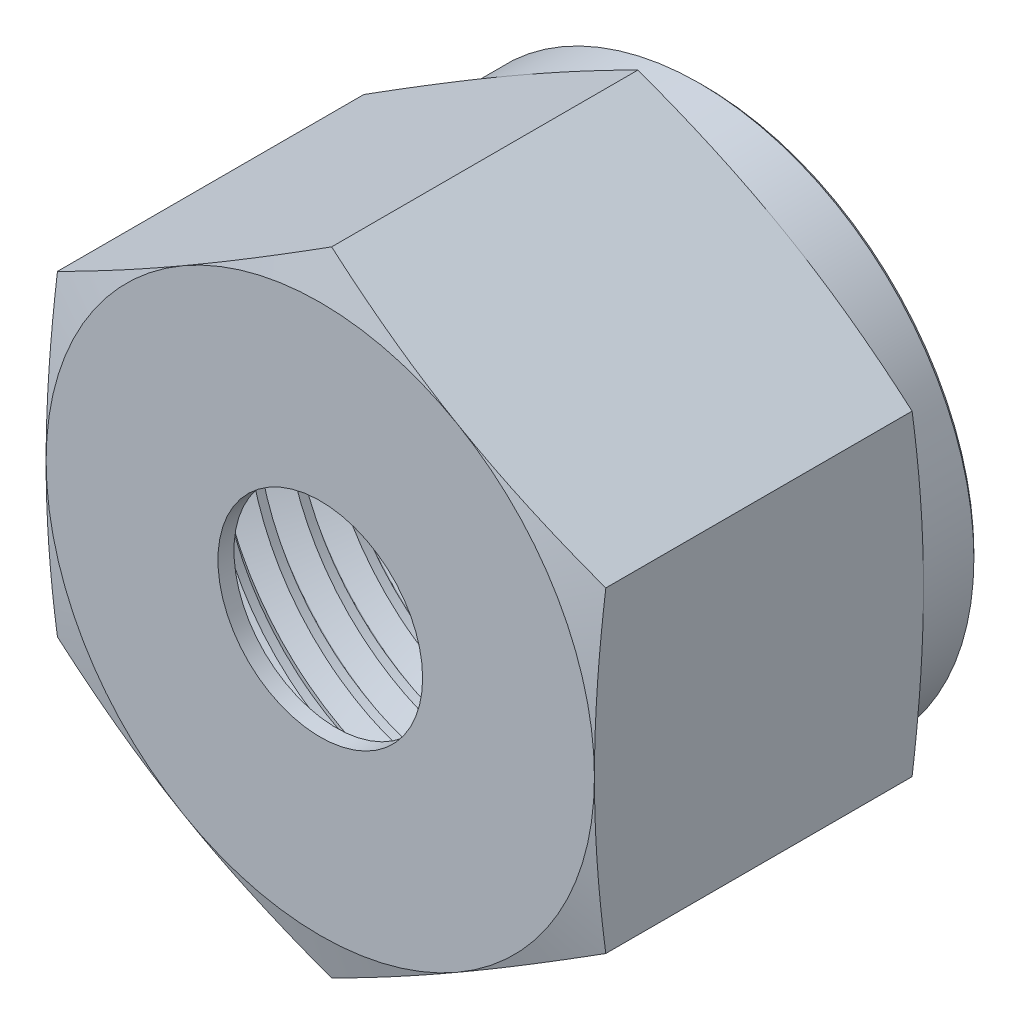
from build123d import *
from build123d.topology import SkipClean

# Parameters (mm, degrees)
BOSS_EXTRUDE1_DEPTH = 25.9334
FILLET1_R           = 1.5748
CHAMFER1_SIZE       = 0.254
CHAMFER2_SIZE       = 0.254
CUT_SWEEP1_PITCH    = 2.116666667
SKETCH7_W           = 9.611261518
SKETCH7_H           = 37.336478418
CUT_EXTRUDE2_DEPTH  = 19.05
SKETCH8_W           = 0.928463728
SKETCH8_H           = 7.62


with BuildPart() as part:
    # Sketch1 → Boss-Extrude1 (new body)
    with BuildSketch(Plane.XY):
        Polygon((0, 18.330871047), (-15.875, 9.165435523), (-15.875, -9.165435523), (0, -18.330871047), (15.875, -9.165435523), (15.875, 9.165435523), align=None)
    extrude(amount=BOSS_EXTRUDE1_DEPTH)

    # Sketch2 → Cut-Revolve1 (revolve, cut)
    with BuildSketch(Plane(origin=(0, 0, 0), x_dir=(0, 0, -1), z_dir=(1, 0, 0))):
        Polygon((-25.9334, 20.786742094), (-25.9334, 15.875), (-22.225, 15.875), (-21.566951336, 18.330871047), (-3.833048664, 18.330871047), (-3.175, 15.875), (0, 15.875), (0, 20.786742094), align=None)
        with BuildLine():
            Line((-25.9334, 10.5918), (-25.9334, 0))
            Line((-25.9334, 0), (0, 0))
            Line((0, 0), (0, 12.720416378))
            Line((0, 12.720416378), (-21.7932, 12.720416378))
            ThreePointArc((-21.7932, 12.720416378), (-21.972805122, 12.6460215), (-22.0472, 12.466416378))
            Line((-22.0472, 12.466416378), (-22.0472, 10.5918))
            Line((-22.0472, 10.5918), (-25.9334, 10.5918))
        make_face()
    revolve(axis=Axis((0, 0, 0), (0, 0, 1)), mode=Mode.SUBTRACT)

    # Fillet1
    fillet1_edges = [part.edges().sort_by_distance(p)[0] for p in [
        (0, -15.875, 25.9334),
    ]]
    fillet(fillet1_edges, radius=FILLET1_R)

    # Chamfer1
    chamfer1_edges = [part.edges().sort_by_distance(p)[0] for p in [
        (0, -15.875, 0),
    ]]
    chamfer(chamfer1_edges, length=CHAMFER1_SIZE)

    # Chamfer2
    chamfer2_edges = [part.edges().sort_by_distance(p)[0] for p in [
        (0, -10.5918, 25.9334),
        (0, -10.5918, 22.0472),
    ]]
    chamfer(chamfer2_edges, length=CHAMFER2_SIZE)

    # Cut-Sweep1: the profile of Sketch4 screwed along a right-hand helix of 10.036 turns, 10 arcs to a turn; built about Z, then put on its axis
    cut_sweep1_z = Axis((0, 0, 0), (0, 0, 1))
    cut_sweep1_corners = [(13.952021776, 0, -0.711067708), (12.505601483, 0, 0.124023437), (12.505601483, 0, -1.744596354), (13.952021776, 0, -0.909505208), (14.009305748, 0, -0.810286458)]
    with BuildLine(mode=Mode.PRIVATE) as cut_sweep1_profile:
        Line(cut_sweep1_corners[0], cut_sweep1_corners[1])
        Line(cut_sweep1_corners[1], cut_sweep1_corners[2])
        Line(cut_sweep1_corners[2], cut_sweep1_corners[3])
        ThreePointArc((13.952021776, 0, -0.909505208), (13.993956554, 0, -0.86757043), (14.009305748, 0, -0.810286458))
        ThreePointArc((14.009305748, 0, -0.810286458), (13.993956554, 0, -0.753002486), (13.952021776, 0, -0.711067708))
    cut_sweep1_cap = Face(cut_sweep1_profile.wire())
    cut_sweep1_arcs = [((13.952021776, 0, -0.909505208), (14.009305748, 0, -0.876432292), (14.009305748, 0, -0.810286458), (1, 0.8660254037844366, 1)), ((14.009305748, 0, -0.810286458), (14.009305748, 0, -0.744140625), (13.952021776, 0, -0.711067708), (1, 0.8660254037844366, 1))]  # start, shoulder, end, weights
    cut_sweep1_turn_angles = [0, 18, 36, 54, 72, 90, 108, 126, 144, 162, 180, 198, 216, 234, 252, 270, 288, 306, 324, 342, 360]
    cut_sweep1_turn_weights = [1, 0.9510565162951535, 1, 0.9510565162951535, 1, 0.9510565162951535, 1, 0.9510565162951535, 1, 0.9510565162951535, 1, 0.9510565162951535, 1, 0.9510565162951535, 1, 0.9510565162951535, 1, 0.9510565162951535, 1, 0.9510565162951535, 1]
    cut_sweep1_turn_rails = [Edge.make_bspline([Vector(p[0], p[1], 0).rotate(cut_sweep1_z, cut_sweep1_turn_angles[k]) / cut_sweep1_turn_weights[k] + Vector(0, 0, p[2] + CUT_SWEEP1_PITCH * cut_sweep1_turn_angles[k] / 360) for k in range(21)], [0, 0, 0, 1, 1, 2, 2, 3, 3, 4, 4, 5, 5, 6, 6, 7, 7, 8, 8, 9, 9, 10, 10, 10], 2, cut_sweep1_turn_weights) for p in cut_sweep1_corners]
    cut_sweep1_turn_sides = [*[Face.make_surface_from_curves(cut_sweep1_turn_rails[p[0]], cut_sweep1_turn_rails[p[1]]) for p in [(0, 1), (1, 2), (2, 3)]], *[Face.make_bezier_surface([[Vector(p[j][0], p[j][1], 0).rotate(cut_sweep1_z, cut_sweep1_turn_angles[2 * i + k]) / cut_sweep1_turn_weights[2 * i + k] + Vector(0, 0, p[j][2] + CUT_SWEEP1_PITCH * cut_sweep1_turn_angles[2 * i + k] / 360) for k in range(3)] for j in range(3)], [[p[3][j] * cut_sweep1_turn_weights[2 * i + k] for k in range(3)] for j in range(3)]) for p in cut_sweep1_arcs for i in range(10)]]
    cut_sweep1_last_angles = [3600, 3606.48, 3612.96]
    cut_sweep1_last_weights = [1, 0.9936113105199756, 1]
    cut_sweep1_last_rails = [Edge.make_bspline([Vector(p[0], p[1], 0).rotate(cut_sweep1_z, cut_sweep1_last_angles[k]) / cut_sweep1_last_weights[k] + Vector(0, 0, p[2] + CUT_SWEEP1_PITCH * cut_sweep1_last_angles[k] / 360) for k in range(3)], [0, 0, 0, 1, 1, 1], 2, cut_sweep1_last_weights) for p in cut_sweep1_corners]
    cut_sweep1_last_sides = [*[Face.make_surface_from_curves(cut_sweep1_last_rails[p[0]], cut_sweep1_last_rails[p[1]]) for p in [(0, 1), (1, 2), (2, 3)]], *[Face.make_bezier_surface([[Vector(p[j][0], p[j][1], 0).rotate(cut_sweep1_z, cut_sweep1_last_angles[2 * i + k]) / cut_sweep1_last_weights[2 * i + k] + Vector(0, 0, p[j][2] + CUT_SWEEP1_PITCH * cut_sweep1_last_angles[2 * i + k] / 360) for k in range(3)] for j in range(3)], [[p[3][j] * cut_sweep1_last_weights[2 * i + k] for k in range(3)] for j in range(3)]) for p in cut_sweep1_arcs for i in range(1)]]
    cut_sweep1 = Plane(origin=(0, 0, 0), x_dir=(0, 1, 0), z_dir=(0, 0, 1)) * Solid(Shell([*[p.moved(Location((0, 0, CUT_SWEEP1_PITCH * i))) for i in range(10) for p in cut_sweep1_turn_sides], *cut_sweep1_last_sides, cut_sweep1_cap, cut_sweep1_cap.rotate(cut_sweep1_z, 3612.96).moved(Location((0, 0, CUT_SWEEP1_PITCH * 3612.96 / 360)))]))
    add(cut_sweep1, mode=Mode.SUBTRACT)

    # Cut-Extrude1 cone 1 section (through the dimple's axis) → Cut-Extrude1 (revolve, cut)
    with BuildSketch(Plane.YZ):
        Polygon((0, 0), (13.4874, 0), (0, 13.4874), align=None)
    revolve(axis=Axis((0, 0, 0), (0, 0, 1)), mode=Mode.SUBTRACT)

    # Sketch6 → Revolve1 (revolve)
    with SkipClean():  # the faces are left unmerged after this step: merging them gives an invalid solid
        with BuildSketch(Plane(origin=(0, 0, 0), x_dir=(0, 0, -1), z_dir=(1, 0, 0))):
            Polygon((-22.0472, 14.123873692), (-13.6398, 14.123873692), (-19.1262, 12.720416378), (-22.0472, 12.720416378), align=None)
        revolve(axis=Axis((0, 0, 0), (0, 0, 1)))

    # Sketch7 → Cut-Extrude2 (cut, symmetric)
    with SkipClean():  # the faces are left unmerged after this step: merging them gives an invalid solid
        with BuildSketch(Plane(origin=(0, 0, 0), x_dir=(0, 0, -1), z_dir=(1, 0, 0))):
            with Locations((-27.030630759, 0)):
                Rectangle(SKETCH7_W, SKETCH7_H)
        extrude(amount=CUT_EXTRUDE2_DEPTH, both=True, mode=Mode.SUBTRACT)

    # Sketch8 → Revolve2 (revolve)
    with SkipClean():  # the faces are left unmerged after this step: merging them gives an invalid solid
        with BuildSketch(Plane(origin=(0, 0, 0), x_dir=(0, 0, -1), z_dir=(1, 0, 0)), mode=Mode.PRIVATE) as revolve2_sk:
            with Locations((-21.760768136, 9.736398481)):
                Rectangle(SKETCH8_W, SKETCH8_H)
        revolve(revolve2_sk.sketch.rotate(Axis((0, 0, 0), (0, 0, -1)), 346.963710167), axis=Axis((0, 0, 0), (0, 0, -1)))


solid = part.part
